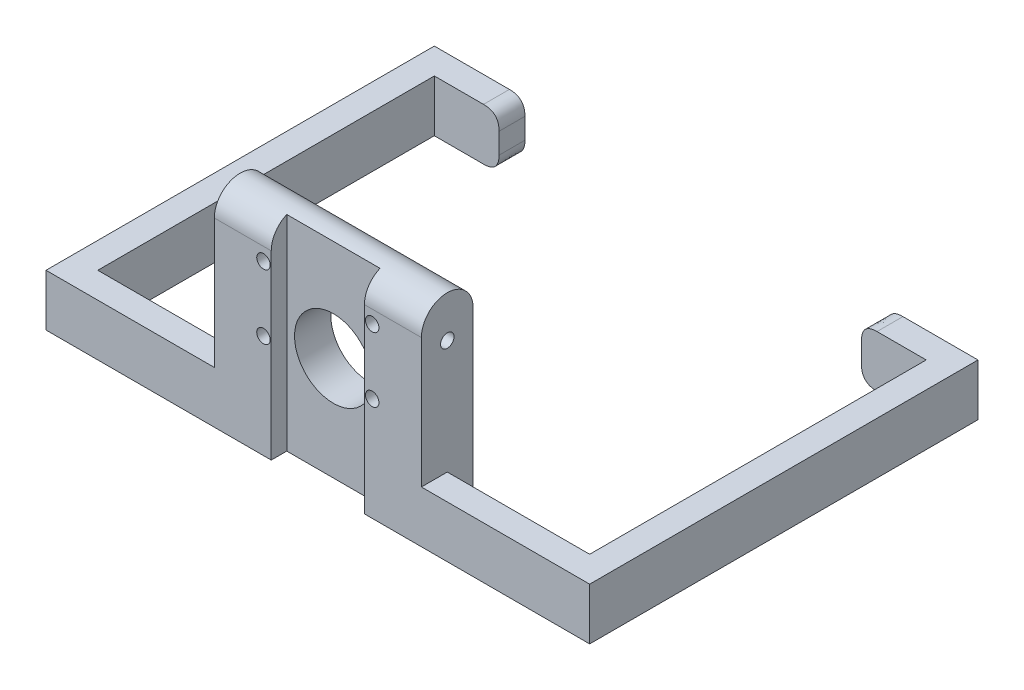
from build123d import *

# Parameters (mm, degrees)
SKETCH_1_W          = 105
SKETCH_1_H          = 75
SKETCH_1_W_2        = 95
SKETCH_1_H_2        = 65
EXTRUDE_1_DEPTH     = 10
SKETCH_2_W          = 40
SKETCH_2_H          = 40
EXTRUDE_2_DEPTH     = 10
CUT_EXTRUDE_1_REACH = 101.906
SKETCH_3_R          = 7.5
CUT_EXTRUDE_2_REACH = 101.906
SKETCH_4_W          = 70
SKETCH_4_H          = 10
FILLET_2_RADIUS     = 5
FILLET_2_LENGTH     = 40
FILLET_3_SIZE       = 3
SKETCH_8_R          = 1.3
CUT_EXTRUDE_3_DEPTH = 100.906206141
SKETCH_9_W          = 18
SKETCH_9_H          = 50
CUT_EXTRUDE_4_DEPTH = 3


with BuildPart() as part:
    # 草圖1 → 填料-伸長1 (new body)
    with BuildSketch(Plane(origin=(0, 0, 0), x_dir=(1, 0, 0), z_dir=(0, 1, 0))):
        Rectangle(SKETCH_1_W, SKETCH_1_H)
        Rectangle(SKETCH_1_W_2, SKETCH_1_H_2, mode=Mode.SUBTRACT)
    extrude(amount=EXTRUDE_1_DEPTH)

    # 草圖2 → 填料-伸長2 (add)
    with BuildSketch(Plane.XY.offset(37.5)):
        with Locations((0, 20)):
            Rectangle(SKETCH_2_W, SKETCH_2_H)
    extrude(amount=-EXTRUDE_2_DEPTH)

    # 草圖3 → 除料-伸長1 (cut, up to next)
    with BuildSketch(Plane.XY.offset(37.5), mode=Mode.PRIVATE) as cut_extrude_1_sk1:
        with Locations((0, 20)):
            Circle(SKETCH_3_R)
    cut_extrude_1_tool1 = extrude(cut_extrude_1_sk1.sketch, amount=-CUT_EXTRUDE_1_REACH, mode=Mode.PRIVATE) & part.part
    add(cut_extrude_1_tool1.solids().sort_by_distance((0, 20, 37.5))[0], mode=Mode.SUBTRACT)

    # 草圖4 → 除料-伸長2 (cut, up to next)
    with BuildSketch(Plane(origin=(0, 0, -37.5), x_dir=(-1, 0, 0), z_dir=(0, 0, -1)), mode=Mode.PRIVATE) as cut_extrude_2_sk1:
        with Locations((0, 5)):
            Rectangle(SKETCH_4_W, SKETCH_4_H)
    cut_extrude_2_tool1 = extrude(cut_extrude_2_sk1.sketch, amount=-CUT_EXTRUDE_2_REACH, mode=Mode.PRIVATE) & part.part
    add(cut_extrude_2_tool1.solids().sort_by_distance((0, 5, -37.5))[0], mode=Mode.SUBTRACT)

    # 草圖7 → Ø1.0 (1) 直徑孔1 (revolve, cut)
    with BuildSketch(Plane(origin=(20, 32, 32.5), x_dir=(0, 0, -1), z_dir=(0, 1, 0))):
        Polygon((0, 0), (0, 7.881118805), (1.3, 7.1), (1.3, 0), align=None)
    hole_wizard_1_0_1_1 = revolve(axis=Axis((26.35, 32, 32.5), (-1, 0, 0)), mode=Mode.SUBTRACT)

    # 鏡射1: Ø1.0 (1) 直徑孔1 across plane
    add(hole_wizard_1_0_1_1.mirror(Plane(origin=(0, 0, 0), x_dir=(0, 0, 1), z_dir=(1, 0, 0))), mode=Mode.SUBTRACT)

    # 圓角2: full round fillet: the end face becomes a half cylinder, R = half its width
    fillet_2_face = Plane((0, 40, 32.5), x_dir=(1, 0, 0), z_dir=(0, 1, 0))  # on the end face: x along it, z out of the body
    fillet_2_slab = fillet_2_face.offset(-FILLET_2_RADIUS / 2) * Box(FILLET_2_LENGTH, 2 * FILLET_2_RADIUS, FILLET_2_RADIUS, mode=Mode.PRIVATE)  # the body's end, R deep
    fillet_2_round = Plane((0, 35, 32.5), x_dir=(0, 1, 0), z_dir=(1, 0, 0)) * Cylinder(FILLET_2_RADIUS, FILLET_2_LENGTH, mode=Mode.PRIVATE)  # its axis R under the face
    add(fillet_2_slab - fillet_2_round, mode=Mode.SUBTRACT)

    # 圓角3
    # a fillet whose section is not a circle: 3 mm, written as the material it takes off along each edge
    with BuildSketch(Plane(origin=(35, 0, -45), x_dir=(0, 1, 0), z_dir=(0, 0, 1)), Plane(origin=(-35, 10, -45), x_dir=(0, -1, 0), z_dir=(0, 0, 1))) as fillet_3_piece_1:
        with BuildLine():
            Bezier((FILLET_3_SIZE, 0), (0, 0), (0, -FILLET_3_SIZE), weights=[1, 1, 1])
            Line((0, -FILLET_3_SIZE), (0, 0))
            Line((0, 0), (FILLET_3_SIZE, 0))
        make_face()
    extrude(amount=20, mode=Mode.SUBTRACT)
    with BuildSketch(Plane(origin=(35, 10, -45), x_dir=(0, -1, 0), z_dir=(0, 0, 1)), Plane(origin=(-35, 0, -45), x_dir=(0, 1, 0), z_dir=(0, 0, 1))) as fillet_3_piece_2:
        with BuildLine():
            Bezier((FILLET_3_SIZE, 0), (0, 0), (0, FILLET_3_SIZE), weights=[1, 1, 1])
            Line((0, FILLET_3_SIZE), (0, 0))
            Line((0, 0), (FILLET_3_SIZE, 0))
        make_face()
    extrude(amount=20, mode=Mode.SUBTRACT)

    # 草圖8 → 除料-伸長3 (cut, through all)
    with BuildSketch(Plane.XY.offset(37.5)):
        with Locations((-10.5, 32.5)):
            Circle(SKETCH_8_R)
        with Locations((-10.5, 20)):
            Circle(SKETCH_8_R)
        with Locations((10.5, 32.5)):
            Circle(SKETCH_8_R)
        with Locations((10.5, 20)):
            Circle(SKETCH_8_R)
    extrude(amount=-CUT_EXTRUDE_3_DEPTH, mode=Mode.SUBTRACT)

    # 草圖9 → 除料-伸長4 (cut)
    with BuildSketch(Plane.XY.offset(37.5)):
        with Locations((0, 20)):
            Rectangle(SKETCH_9_W, SKETCH_9_H)
    extrude(amount=-CUT_EXTRUDE_4_DEPTH, mode=Mode.SUBTRACT)


solid = part.part
